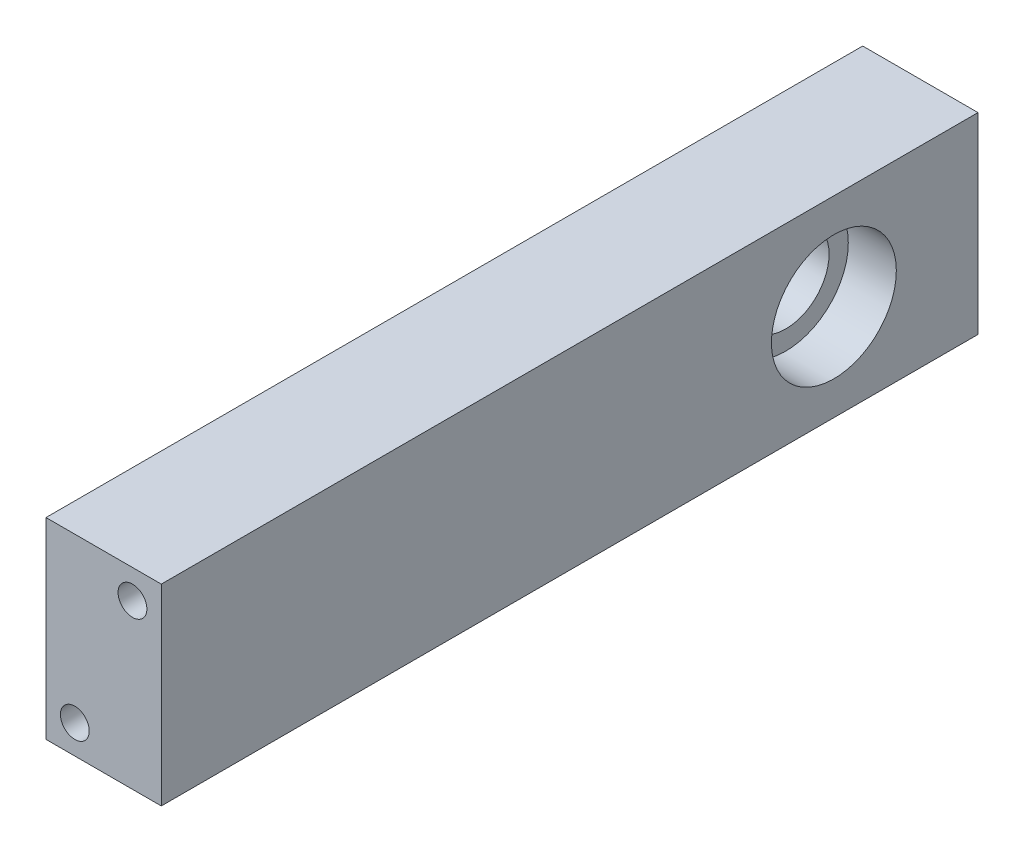
from build123d import *

# Parameters (mm, degrees)
SZKIC1_W                    = 12
SZKIC1_H                    = 20
DODANIE_WYCI_GNI_CIE1_DEPTH = 85
SZKIC2_R                    = 1.5
WYTNIJ_WYCI_GNI_CIE1_DEPTH  = 10
SZKIC5_R                    = 6.5
WYTNIJ_WYCI_GNI_CIE4_DEPTH  = 5
SZKIC6_R                    = 4.5
WYTNIJ_WYCI_GNI_CIE5_DEPTH  = 87.423376467


with BuildPart() as part:
    # Szkic1 → Dodanie-wyciągnięcie1 (new body)
    with BuildSketch(Plane.XY):
        Rectangle(SZKIC1_W, SZKIC1_H)
    extrude(amount=DODANIE_WYCI_GNI_CIE1_DEPTH)

    # Szkic2 → Wytnij-wyciągnięcie1 (cut)
    with BuildSketch(Plane.XY.offset(85)):
        with Locations((3, 7)):
            Circle(SZKIC2_R)
        with Locations((-3, -7)):
            Circle(SZKIC2_R)
    extrude(amount=-WYTNIJ_WYCI_GNI_CIE1_DEPTH, mode=Mode.SUBTRACT)

    # Szkic5 → Wytnij-wyciągnięcie4 (cut)
    with BuildSketch(Plane(origin=(6, 0, 0), x_dir=(0, 0, -1), z_dir=(1, 0, 0))):
        with Locations((-15, 0)):
            Circle(SZKIC5_R)
    extrude(amount=-WYTNIJ_WYCI_GNI_CIE4_DEPTH, mode=Mode.SUBTRACT)

    # Szkic6 → Wytnij-wyciągnięcie5 (cut, through all)
    with BuildSketch(Plane.ZY.offset(6)):
        with Locations((15, 0)):
            Circle(SZKIC6_R)
    extrude(amount=-WYTNIJ_WYCI_GNI_CIE5_DEPTH, mode=Mode.SUBTRACT)


solid = part.part
